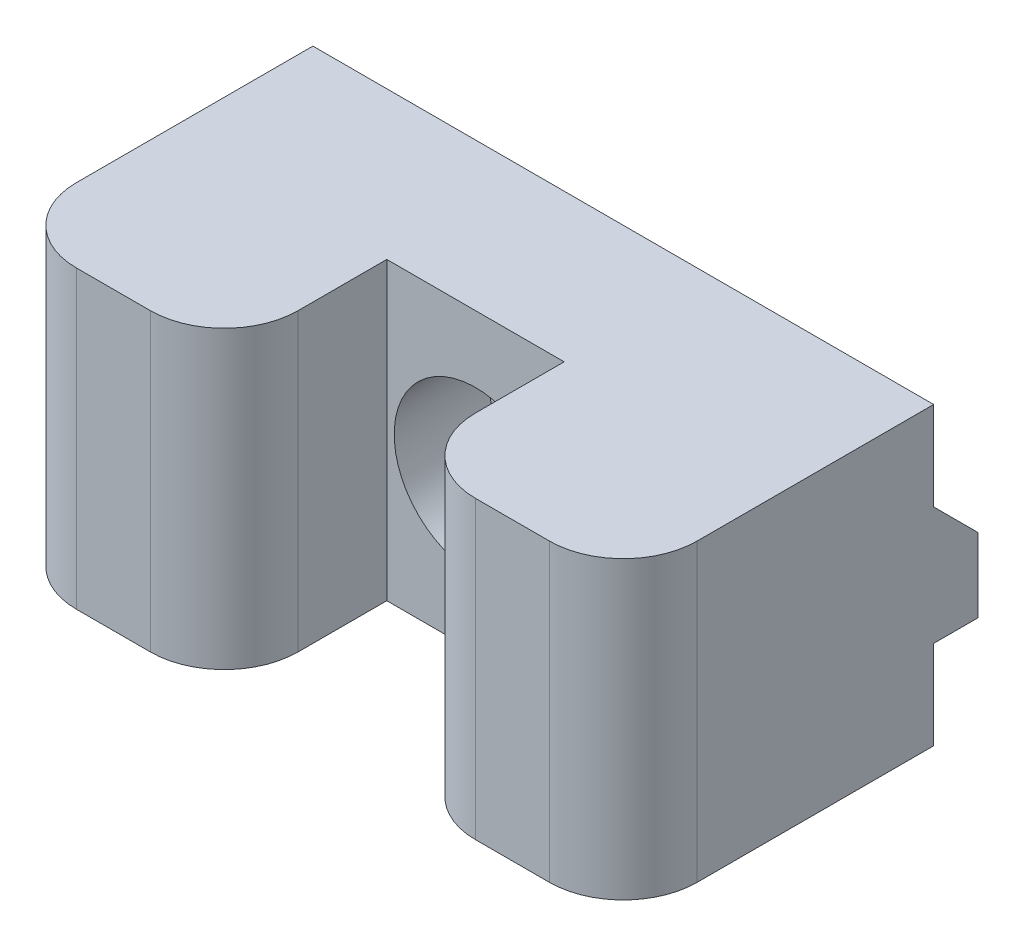
from build123d import *

# Parameters (mm, degrees)
BASE_SKETCH_W           = 42
BASE_SKETCH_H           = 20
BASE_DEPTH              = 10
MAGNET_TOWER_SKETCH_W   = 15
MAGNET_TOWER_SKETCH_H   = 11
MAGNET_TOWER_DEPTH      = 20
MAGNET_HOLES_SKETCH_R   = 5.5
MAGNET_HOLES_DEPTH      = 5
MOUNT_SCREW_D           = 6.6
MOUNT_SCREW_CBORE_D     = 11
MOUNT_SCREW_CBORE_DEPTH = 6.4
ROUNDING_R              = 5
PROFILE_CLIP_DEPTH      = 3
PROFILE_CLIP_ANGLE_SIZE = 3


with BuildPart() as part:
    # Base sketch → Base (new body)
    with BuildSketch(Plane.XY):
        Rectangle(BASE_SKETCH_W, BASE_SKETCH_H)
    extrude(amount=BASE_DEPTH)

    # Magnet tower sketch → Magnet tower (add)
    with BuildSketch(Plane.XZ.offset(10)):
        with Locations((-13.5, 15.5)):
            Rectangle(MAGNET_TOWER_SKETCH_W, MAGNET_TOWER_SKETCH_H)
        with Locations((13.5, 15.5)):
            Rectangle(MAGNET_TOWER_SKETCH_W, MAGNET_TOWER_SKETCH_H)
    extrude(amount=-MAGNET_TOWER_DEPTH)

    # Magnet holes sketch → Magnet holes (cut)
    with BuildSketch(Plane.XZ.offset(10)):
        with Locations(Location((-13.5, 14, 0), (0, 0, 270))):
            Circle(MAGNET_HOLES_SKETCH_R)
        with Locations(Location((13.5, 14, 0), (0, 0, 270))):
            Circle(MAGNET_HOLES_SKETCH_R)
    extrude(amount=-MAGNET_HOLES_DEPTH, mode=Mode.SUBTRACT)

    # Mount screw (through all)
    with Locations(Plane.XY.offset(10)):
        with Locations((0, 0)):
            CounterBoreHole(MOUNT_SCREW_D / 2, MOUNT_SCREW_CBORE_D / 2, MOUNT_SCREW_CBORE_DEPTH)

    # Rounding
    rounding_edges = [part.edges().sort_by_distance(p)[0] for p in [
        (-21, 0, 21),
        (-6, 0, 21),
        (21, 0, 21),
        (6, 0, 21),
    ]]
    fillet(rounding_edges, radius=ROUNDING_R)

    # Profile clip sketch → Profile clip (add)
    with BuildSketch(Plane(origin=(0, 0, 0), x_dir=(-1, 0, 0), z_dir=(0, 0, -1))):
        with BuildLine():
            Line((-8.062257748, 4), (-21, 4))
            Line((-21, 4), (-21, -4))
            Line((-21, -4), (-8.062257748, -4))
            ThreePointArc((-8.062257748, -4), (-9, 0), (-8.062257748, 4))
        make_face()
        with BuildLine():
            Line((21, 4), (8.062257748, 4))
            ThreePointArc((8.062257748, 4), (8.762428879, 2.054224947), (9, 0))
            ThreePointArc((9, 0), (8.762428879, -2.054224947), (8.062257748, -4))
            Line((8.062257748, -4), (21, -4))
            Line((21, -4), (21, 4))
        make_face()
    extrude(amount=PROFILE_CLIP_DEPTH)

    # Profile clip angle
    profile_clip_angle_edges = [part.edges().sort_by_distance(p)[0] for p in [
        (-14.531128874, 4, -3),
        (14.531128874, 4, -3),
    ]]
    chamfer(profile_clip_angle_edges, length=PROFILE_CLIP_ANGLE_SIZE - 0.0001)  # a hair under: the kernel refuses the full size


solid = part.part
